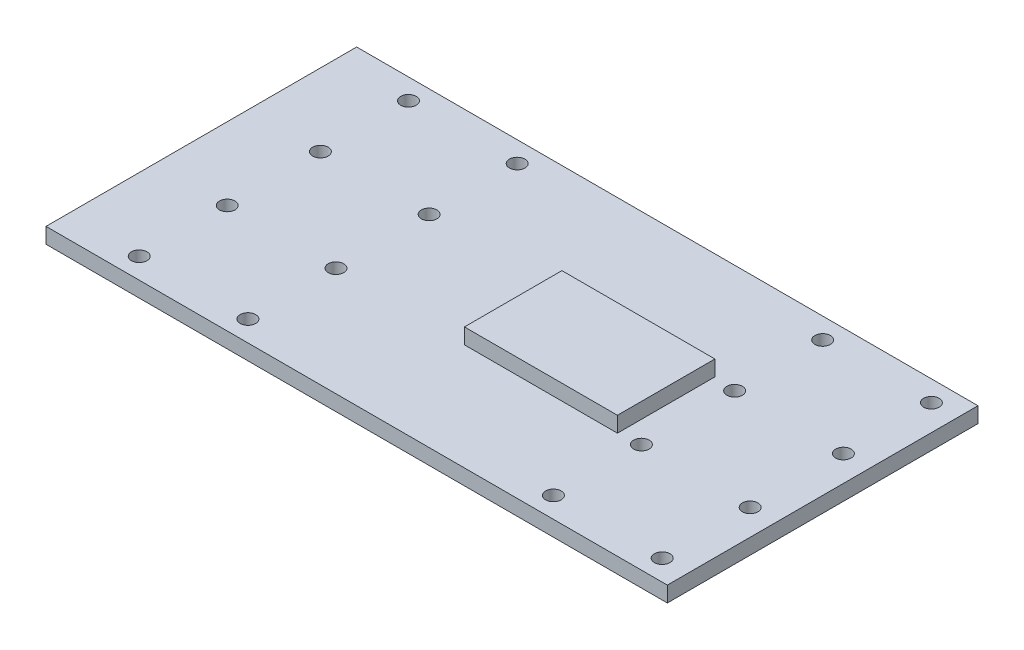
from build123d import *

# Parameters (mm, degrees)
SKETCH1_W           = 120
SKETCH1_H           = 60
SKETCH1_R           = 1.5
BOSS_EXTRUDE1_DEPTH = 3
SKETCH2_W           = 29.54925432
SKETCH2_H           = 18.825060972
BOSS_EXTRUDE2_DEPTH = 3


with BuildPart() as part:
    # Sketch1 → Boss-Extrude1 (new body)
    with BuildSketch(Plane(origin=(0, 0, 0), x_dir=(1, 0, 0), z_dir=(0, 1, 0))):
        Rectangle(SKETCH1_W, SKETCH1_H)
        with Locations((-25, 26)):
            Circle(SKETCH1_R, mode=Mode.SUBTRACT)
        with Locations((-46, 26)):
            Circle(SKETCH1_R, mode=Mode.SUBTRACT)
        with Locations((-46, 9)):
            Circle(SKETCH1_R, mode=Mode.SUBTRACT)
        with Locations((-25, 9)):
            Circle(SKETCH1_R, mode=Mode.SUBTRACT)
        with Locations((-25, -9)):
            Circle(SKETCH1_R, mode=Mode.SUBTRACT)
        with Locations((-46, -9)):
            Circle(SKETCH1_R, mode=Mode.SUBTRACT)
        with Locations((-25, -26)):
            Circle(SKETCH1_R, mode=Mode.SUBTRACT)
        with Locations((-46, -26)):
            Circle(SKETCH1_R, mode=Mode.SUBTRACT)
        with Locations((55, 26)):
            Circle(SKETCH1_R, mode=Mode.SUBTRACT)
        with Locations((34, 26)):
            Circle(SKETCH1_R, mode=Mode.SUBTRACT)
        with Locations((34, -9)):
            Circle(SKETCH1_R, mode=Mode.SUBTRACT)
        with Locations((55, -9)):
            Circle(SKETCH1_R, mode=Mode.SUBTRACT)
        with Locations((55, -26)):
            Circle(SKETCH1_R, mode=Mode.SUBTRACT)
        with Locations((34, -26)):
            Circle(SKETCH1_R, mode=Mode.SUBTRACT)
        with Locations((55, 9)):
            Circle(SKETCH1_R, mode=Mode.SUBTRACT)
        with Locations((34, 9)):
            Circle(SKETCH1_R, mode=Mode.SUBTRACT)
    extrude(amount=BOSS_EXTRUDE1_DEPTH)

    # Sketch2 → Boss-Extrude2 (add)
    with BuildSketch(Plane(origin=(0, 3, 0), x_dir=(1, 0, 0), z_dir=(0, 1, 0))):
        with Locations((15, 0)):
            Rectangle(SKETCH2_W, SKETCH2_H)
    extrude(amount=BOSS_EXTRUDE2_DEPTH)


solid = part.part
